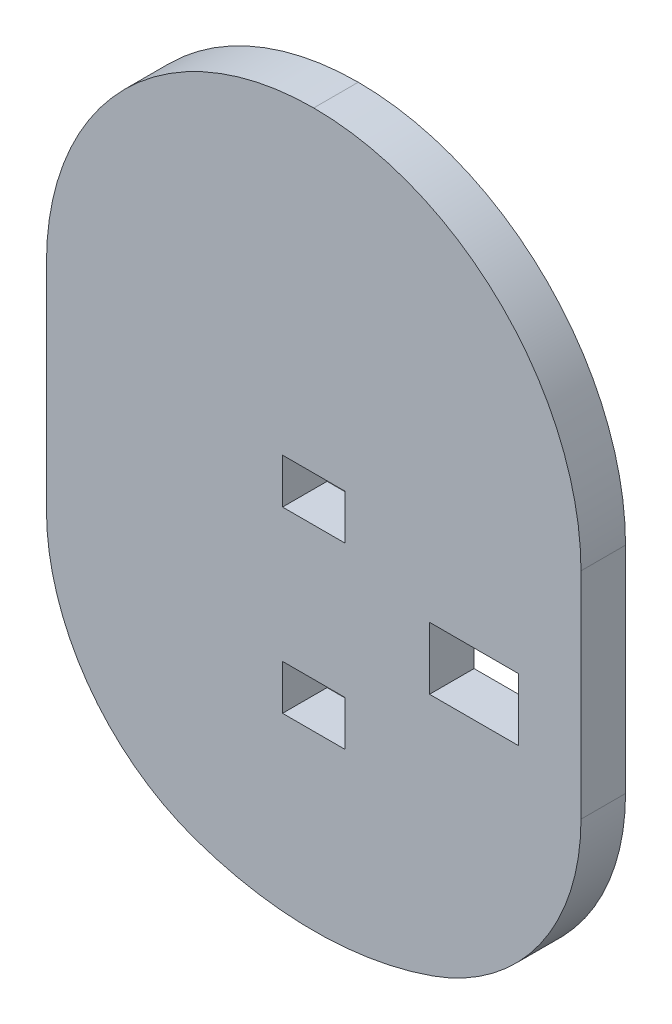
from build123d import *

# Parameters (mm, degrees)
SKETCH1_R           = 40
BOSS_EXTRUDE1_DEPTH = 5
CUT_EXTRUDE3_START  = -10
CUT_EXTRUDE3_DEPTH  = 10
FILLET1_R           = 30
FILLET2_R           = 25
SKETCH14_W          = 7
SKETCH14_H          = 5.05
CUT_EXTRUDE4_DEPTH  = 10
SKETCH18_W          = 10
SKETCH18_H          = 7
CUT_EXTRUDE6_DEPTH  = 10
SKETCH20_R          = 8.5
CUT_EXTRUDE8_DEPTH  = 1


with BuildPart() as part:
    # Sketch1 → Boss-Extrude1 (new body)
    with BuildSketch(Plane.XY):
        Circle(SKETCH1_R)
    extrude(amount=BOSS_EXTRUDE1_DEPTH)

    # Sketch10 → Cut-Extrude3 (cut)
    with BuildSketch(Plane.XY.offset(5).offset(CUT_EXTRUDE3_START)):
        with BuildLine():
            Line((-30, 26.457513111), (-30, -26.457513111))
            ThreePointArc((-30, -26.457513111), (-40, 0), (-30, 26.457513111))
        make_face()
        with BuildLine():
            Line((30, 26.457513111), (30, -26.457513111))
            ThreePointArc((30, -26.457513111), (40, 0), (30, 26.457513111))
        make_face()
    extrude(amount=CUT_EXTRUDE3_DEPTH, mode=Mode.SUBTRACT)

    # Fillet1
    fillet1_edges = [part.edges().sort_by_distance(p)[0] for p in [
        (-30, 26.457513111, 2.5),
        (30, 26.457513111, 2.5),
    ]]
    fillet(fillet1_edges, radius=FILLET1_R - 0.0001)  # a hair under: the kernel refuses the full size

    # Fillet2
    fillet2_edges = [part.edges().sort_by_distance(p)[0] for p in [
        (-30, -26.457513111, 2.5),
        (30, -26.457513111, 2.5),
    ]]
    fillet(fillet2_edges, radius=FILLET2_R)

    # Sketch14 → Cut-Extrude4 (cut)
    with BuildSketch(Plane.XY.offset(5)):
        with Locations((0, 1.975)):
            Rectangle(SKETCH14_W, SKETCH14_H)
        with Locations((0, -18.075)):
            Rectangle(SKETCH14_W, SKETCH14_H)
    extrude(amount=-CUT_EXTRUDE4_DEPTH, mode=Mode.SUBTRACT)

    # Sketch18 → Cut-Extrude6 (cut)
    with BuildSketch(Plane(origin=(0, 0, 0), x_dir=(-1, 0, 0), z_dir=(0, 0, -1))):
        with Locations((-18, -7)):
            Rectangle(SKETCH18_W, SKETCH18_H)
    extrude(amount=-CUT_EXTRUDE6_DEPTH, mode=Mode.SUBTRACT)

    # Sketch20 → Cut-Extrude8 (cut)
    with BuildSketch(Plane(origin=(0, 0, 0), x_dir=(-1, 0, 0), z_dir=(0, 0, -1))):
        with Locations((-17.5, 20)):
            Circle(SKETCH20_R)
        with Locations((17.5, 20)):
            Circle(SKETCH20_R)
        with Locations((17.5, -20)):
            Circle(SKETCH20_R)
        with Locations((-17.5, -20)):
            Circle(SKETCH20_R)
    extrude(amount=-CUT_EXTRUDE8_DEPTH, mode=Mode.SUBTRACT)


solid = part.part
